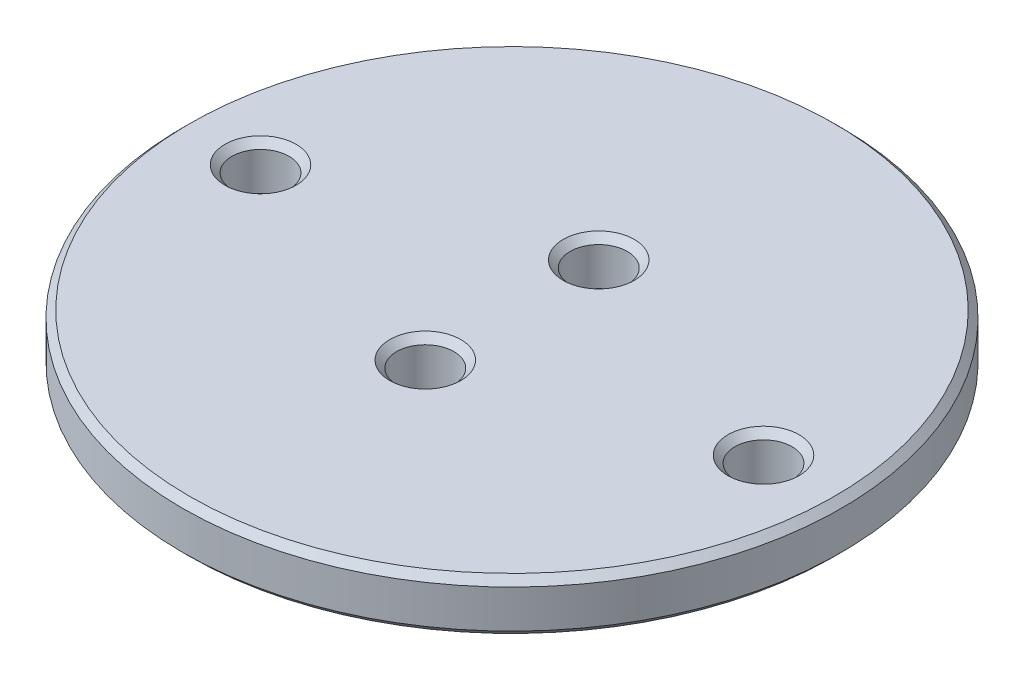
from build123d import *

# Parameters (mm, degrees)
SKETCH1_R           = 19
SKETCH1_R_2         = 1.65
BOSS_EXTRUDE1_DEPTH = 3
CHAMFER1_SIZE       = 0.4


with BuildPart() as part:
    # Sketch1 → Boss-Extrude1 (new body)
    with BuildSketch(Plane(origin=(0, 0, 0), x_dir=(1, 0, 0), z_dir=(0, 1, 0))):
        Circle(SKETCH1_R)
        with Locations((-14.5, 0)):
            Circle(SKETCH1_R_2, mode=Mode.SUBTRACT)
        with Locations((14.5, 0)):
            Circle(SKETCH1_R_2, mode=Mode.SUBTRACT)
        with Locations((0, 5)):
            Circle(SKETCH1_R_2, mode=Mode.SUBTRACT)
        with Locations((0, -5)):
            Circle(SKETCH1_R_2, mode=Mode.SUBTRACT)
    extrude(amount=BOSS_EXTRUDE1_DEPTH)

    # Chamfer1
    chamfer1_edges = [part.edges().sort_by_distance(p)[0] for p in [
        (-1.65, 0, 5),
        (-1.65, 0, -5),
        (12.85, 0, 0),
        (-16.15, 0, 0),
        (-19, 0, 0),
        (-1.65, 3, 5),
        (12.85, 3, 0),
        (-19, 3, 0),
        (-16.15, 3, 0),
        (-1.65, 3, -5),
    ]]
    chamfer(chamfer1_edges, length=CHAMFER1_SIZE)


solid = part.part
